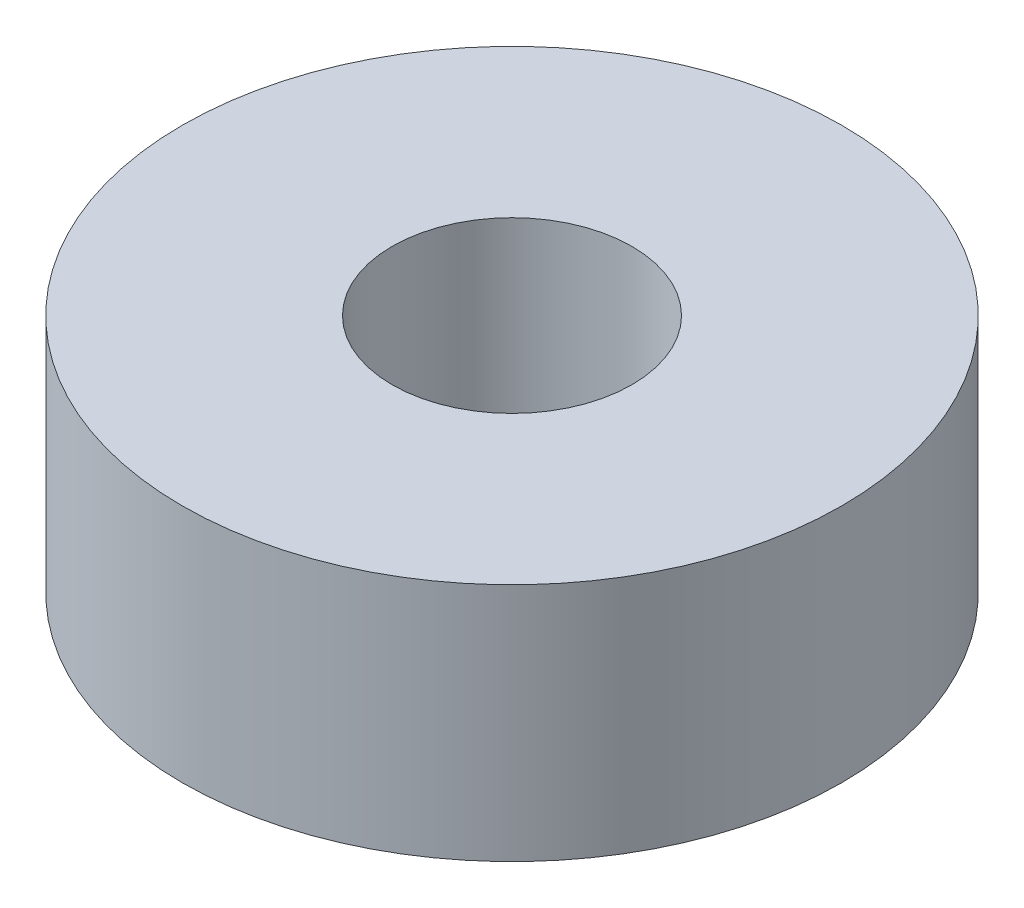
from build123d import *

# Parameters (mm, degrees)
SKETCH1_R           = 11
BOSS_EXTRUDE1_DEPTH = 8
SKETCH2_R           = 4
CUT_EXTRUDE1_DEPTH  = 18.492855685


with BuildPart() as part:
    # Sketch1 → Boss-Extrude1 (new body)
    with BuildSketch(Plane(origin=(0, 0, 0), x_dir=(1, 0, 0), z_dir=(0, 1, 0))):
        Circle(SKETCH1_R)
    extrude(amount=BOSS_EXTRUDE1_DEPTH)

    # Sketch2 → Cut-Extrude1 (cut, through all)
    with BuildSketch(Plane(origin=(0, 8, 0), x_dir=(1, 0, 0), z_dir=(0, 1, 0))):
        Circle(SKETCH2_R)
    extrude(amount=-CUT_EXTRUDE1_DEPTH, mode=Mode.SUBTRACT)


solid = part.part
